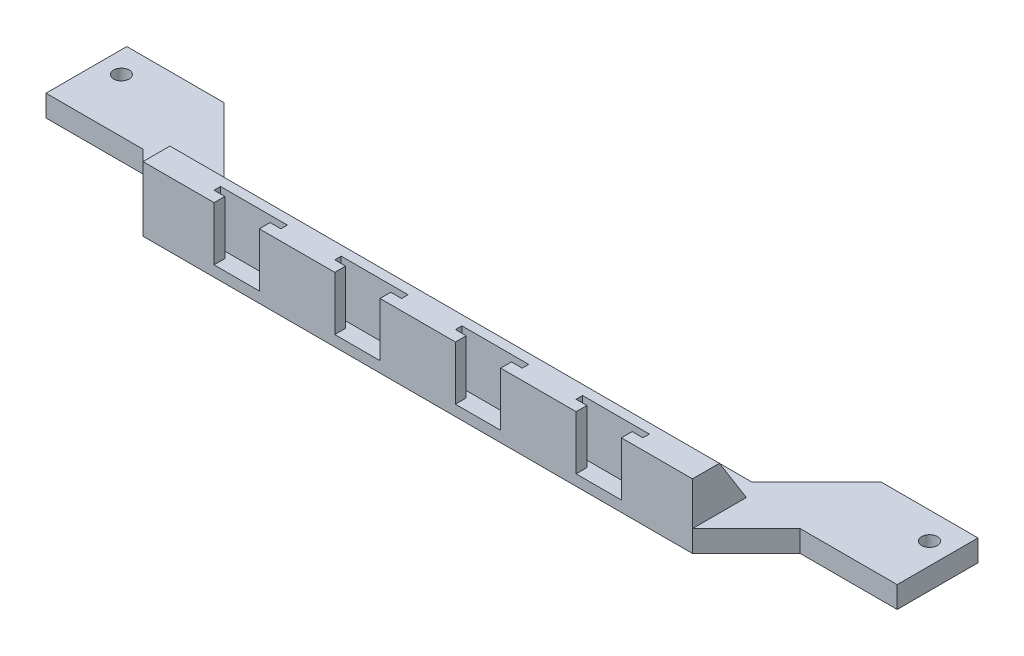
from build123d import *

# Parameters (mm, degrees)
SKETCH_1_W          = 160
SKETCH_1_H          = 25
EXTRUDE_1_DEPTH     = 4
SKETCH_3_R          = 1.45
CUT_EXTRUDE_1_DEPTH = 4
SKETCH_5_W          = 102
SKETCH_5_H          = 10
EXTRUDE_2_DEPTH     = 8
SKETCH_6_W          = 29
SKETCH_6_H          = 10
CUT_EXTRUDE_2_DEPTH = 6
CHAMFER_1_SIZE      = 10
CUT_EXTRUDE_3_DEPTH = 10
CUT_EXTRUDE_4_DEPTH = 142
SKETCH_10_W         = 122
SKETCH_10_H         = 12
CUT_EXTRUDE_5_DEPTH = 142
CHAMFER_2_SIZE      = 12
SKETCH_11_W         = 15
SKETCH_11_H         = 4
CUT_EXTRUDE_6_DEPTH = 1
SKETCH_12_W         = 15
SKETCH_12_H         = 4
CUT_EXTRUDE_7_DEPTH = 1


with BuildPart() as part:
    # 草图1 → 凸台-拉伸1 (new body)
    with BuildSketch(Plane(origin=(0, 0, 0), x_dir=(1, 0, 0), z_dir=(0, 1, 0))):
        Rectangle(SKETCH_1_W, SKETCH_1_H)
    extrude(amount=EXTRUDE_1_DEPTH)

    # 草图3 → 切除-拉伸1 (cut)
    with BuildSketch(Plane(origin=(0, 4, 0), x_dir=(1, 0, 0), z_dir=(0, 1, 0))):
        with Locations(Location((-75, 7.5, 0), (0, 0, 270))):
            Circle(SKETCH_3_R)
        with Locations(Location((75, 7.5, 0), (0, 0, 270))):
            Circle(SKETCH_3_R)
    extrude(amount=-CUT_EXTRUDE_1_DEPTH, mode=Mode.SUBTRACT)

    # 草图5 → 凸台-拉伸2 (add)
    with BuildSketch(Plane(origin=(0, 4, 0), x_dir=(1, 0, 0), z_dir=(0, 1, 0))):
        with Locations((0, -7.5)):
            Rectangle(SKETCH_5_W, SKETCH_5_H)
    extrude(amount=EXTRUDE_2_DEPTH)

    # 草图6 → 切除-拉伸2 (cut)
    with BuildSketch(Plane(origin=(0, 4, 0), x_dir=(1, 0, 0), z_dir=(0, 1, 0))):
        with Locations((-65.5, -7.5)):
            Rectangle(SKETCH_6_W, SKETCH_6_H)
        with Locations((65.5, -7.5)):
            Rectangle(SKETCH_6_W, SKETCH_6_H)
    extrude(amount=-CUT_EXTRUDE_2_DEPTH, mode=Mode.SUBTRACT)

    # 倒角1
    chamfer_1_edges = [part.edges().sort_by_distance(p)[0] for p in [
        (51, 2, 2.5),
        (-51, 2, 2.5),
    ]]
    chamfer(chamfer_1_edges, length=CHAMFER_1_SIZE - 0.0001)  # a hair under: the kernel refuses the full size

    # 草图7 → 切除-拉伸3 (cut)
    with BuildSketch(Plane(origin=(0, 12, 0), x_dir=(1, 0, 0), z_dir=(0, 1, 0))):
        Polygon((-39.8, -9.3), (-27.4, -9.3), (-27.4, -10.5), (-29.4, -10.5), (-29.4, -12.5), (-37.8, -12.5), (-37.8, -10.5), (-39.8, -10.5), align=None)
        Polygon((-17.4, -9.3), (-5, -9.3), (-5, -10.5), (-7, -10.5), (-7, -12.5), (-15.4, -12.5), (-15.4, -10.5), (-17.4, -10.5), align=None)
        Polygon((5, -9.3), (17.4, -9.3), (17.4, -10.5), (15.4, -10.5), (15.4, -12.5), (7, -12.5), (7, -10.5), (5, -10.5), align=None)
        Polygon((27.4, -9.3), (39.8, -9.3), (39.8, -10.5), (37.8, -10.5), (37.8, -12.5), (29.4, -12.5), (29.4, -10.5), (27.4, -10.5), align=None)
    extrude(amount=-CUT_EXTRUDE_3_DEPTH, mode=Mode.SUBTRACT)

    # 草图9 → 切除-拉伸4 (cut)
    with BuildSketch(Plane.ZY.offset(51)):
        Polygon((7.5, 12), (2.5, 4), (2.5, 12), align=None)
    extrude(amount=-CUT_EXTRUDE_4_DEPTH, mode=Mode.SUBTRACT)

    # 草图10 → 切除-拉伸5 (cut)
    with BuildSketch(Plane(origin=(0, 4, 0), x_dir=(1, 0, 0), z_dir=(0, 1, 0))):
        with Locations((0, 6.5)):
            Rectangle(SKETCH_10_W, SKETCH_10_H)
    extrude(amount=-CUT_EXTRUDE_5_DEPTH, mode=Mode.SUBTRACT)

    # 倒角2
    chamfer_2_edges = [part.edges().sort_by_distance(p)[0] for p in [
        (-61, 2, -0.5),
        (61, 2, -0.5),
    ]]
    chamfer(chamfer_2_edges, length=CHAMFER_2_SIZE - 0.0001)  # a hair under: the kernel refuses the full size

    # 草图11 → 切除-拉伸6 (cut)
    with BuildSketch(Plane.ZY.offset(80)):
        with Locations((-5, 2)):
            Rectangle(SKETCH_11_W, SKETCH_11_H)
    extrude(amount=-CUT_EXTRUDE_6_DEPTH, mode=Mode.SUBTRACT)

    # 草图12 → 切除-拉伸7 (cut)
    with BuildSketch(Plane(origin=(80, 0, 0), x_dir=(0, 0, -1), z_dir=(1, 0, 0))):
        with Locations((5, 2)):
            Rectangle(SKETCH_12_W, SKETCH_12_H)
    extrude(amount=-CUT_EXTRUDE_7_DEPTH, mode=Mode.SUBTRACT)


solid = part.part
